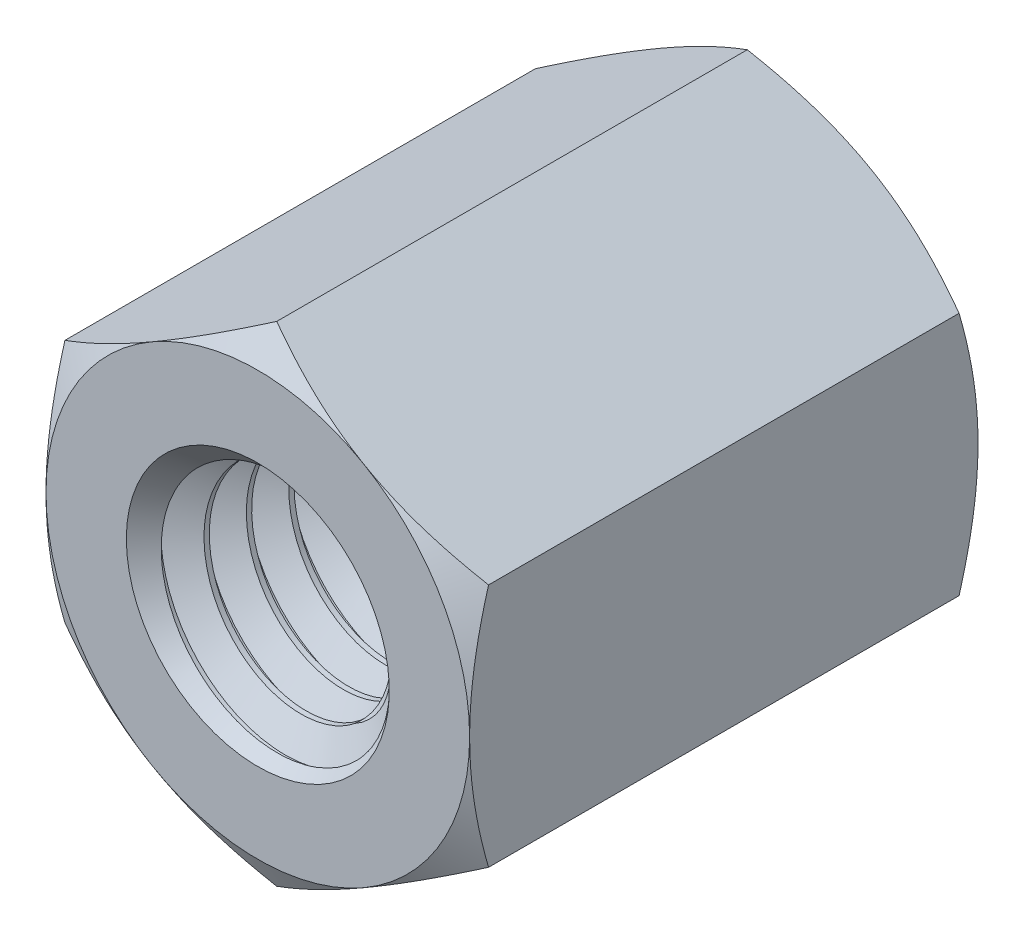
from build123d import *

# Parameters (mm, degrees)
EXTRUDE1_DEPTH          = 4.7625
EXTRUDE1_DEPTH_BACK     = 4.7625
SKETCH1_R               = 2.413
SWEEP1_PITCH            = 0.79375
EXTRUDE2_DEPTH          = 12.967976376
SKETCH8_OUTSIDE_W       = 58.044
SKETCH8_OUTSIDE_H       = 59.272
SKETCH8_OUTSIDE_R       = 3.96875
EXTRUDE4_DEPTH          = 12.967976376
EXTRUDE4_DRAFT          = -60
MIRROR1_COPY_1_SKETCH_W = 58.044
MIRROR1_COPY_1_SKETCH_H = 59.272
MIRROR1_COPY_1_SKETCH_R = 3.96875
MIRROR1_COPY_1_DEPTH    = 12.967976376
MIRROR1_COPY_1_DRAFT    = -60


with BuildPart() as part:
    # Sketch1 → Extrude1 (new, two sides: drawn at the far end of the back side and taken through both)
    with BuildSketch(Plane.XY.offset(-EXTRUDE1_DEPTH_BACK)):
        Polygon((0, 4.582717762), (-3.96875, 2.291358881), (-3.96875, -2.291358881), (0, -4.582717762), (3.96875, -2.291358881), (3.96875, 2.291358881), align=None)
        with Locations(Location((0, 0, 0), (0, 0, 180))):
            Circle(SKETCH1_R, mode=Mode.SUBTRACT)
    extrude(amount=EXTRUDE1_DEPTH + EXTRUDE1_DEPTH_BACK)

    # Sweep1: the profile of Sketch12 profile screwed along a right-hand helix of 13 turns, 8 arcs to a turn; built about Z, then put on its axis
    sweep1_z = Axis((0, 0, 0), (0, 0, 1))
    sweep1_corners = [(2.4133, 0, -0.694704455), (2.4133, 0, 0.000173205), (1.897444252, 0, -0.29765625), (1.897444252, 0, -0.396875)]
    with BuildLine(mode=Mode.PRIVATE) as sweep1_profile:
        Line(sweep1_corners[0], sweep1_corners[1])
        Line(sweep1_corners[1], sweep1_corners[2])
        Line(sweep1_corners[2], sweep1_corners[3])
        Line(sweep1_corners[3], sweep1_corners[0])
    sweep1_cap = Face(sweep1_profile.wire())
    sweep1_turn_angles = [0, 22.5, 45, 67.5, 90, 112.5, 135, 157.5, 180, 202.5, 225, 247.5, 270, 292.5, 315, 337.5, 360]
    sweep1_turn_weights = [1, 0.9238795325112867, 1, 0.9238795325112867, 1, 0.9238795325112867, 1, 0.9238795325112867, 1, 0.9238795325112867, 1, 0.9238795325112867, 1, 0.9238795325112867, 1, 0.9238795325112867, 1]
    sweep1_turn_rails = [Edge.make_bspline([Vector(p[0], p[1], 0).rotate(sweep1_z, sweep1_turn_angles[k]) / sweep1_turn_weights[k] + Vector(0, 0, p[2] + SWEEP1_PITCH * sweep1_turn_angles[k] / 360) for k in range(17)], [0, 0, 0, 1, 1, 2, 2, 3, 3, 4, 4, 5, 5, 6, 6, 7, 7, 8, 8, 8], 2, sweep1_turn_weights) for p in sweep1_corners]
    sweep1_turn_sides = [Face.make_surface_from_curves(sweep1_turn_rails[p[0]], sweep1_turn_rails[p[1]]) for p in [(0, 1), (1, 2), (2, 3), (3, 0)]]
    sweep1 = Plane(origin=(0, 0, -4.7625), x_dir=(0, 1, 0), z_dir=(0, 0, 1)) * Solid(Shell([*[p.moved(Location((0, 0, SWEEP1_PITCH * i))) for i in range(13) for p in sweep1_turn_sides], sweep1_cap, sweep1_cap.rotate(sweep1_z, 4680).moved(Location((0, 0, SWEEP1_PITCH * 4680 / 360)))]))
    add(sweep1)

    # Sketch6 → Extrude2 (cut, through all)
    with BuildSketch(Plane(origin=(0, 0, -4.7625), x_dir=(-1, 0, 0), z_dir=(0, 0, -1))):
        Polygon((0, 4.582717762), (-3.96875, 2.291358881), (-3.96875, -2.291358881), (0, -4.582717762), (3.96875, -2.291358881), (3.96875, 2.291358881), align=None)
    extrude2 = extrude(amount=EXTRUDE2_DEPTH, mode=Mode.SUBTRACT)

    # Extrude3 cone 1 section (through the dimple's axis) → Extrude3 (revolve, cut)
    with BuildSketch(Plane(origin=(0, 0, -4.7625), x_dir=(0, 1, 0), z_dir=(1, 0, 0))):
        Polygon((0, 0), (2.4638, 0), (0, 2.642102028), align=None)
    extrude3 = revolve(axis=Axis((0, 0, -4.7625), (0, 0, 1)), mode=Mode.SUBTRACT)


with BuildPart() as extrude4_tool:
    # Sketch8 outside → Extrude4 (with draft: the straight prism first)
    with BuildSketch(Plane(origin=(0, 0, -4.7625), x_dir=(-1, 0, 0), z_dir=(0, 0, -1))):
        Rectangle(SKETCH8_OUTSIDE_W, SKETCH8_OUTSIDE_H)
        Circle(SKETCH8_OUTSIDE_R, mode=Mode.SUBTRACT)
    extrude(amount=-EXTRUDE4_DEPTH)
    # Extrude4: the draft: its side faces are tilted about the plane it starts from
    extrude4_sides = [extrude4_tool.faces().sort_by_distance(p)[0] for p in [
        (0, -29.636, 1.721488188),
        (-29.022, 0, 1.721488188),
        (0, 29.636, 1.721488188),
        (29.022, 0, 1.721488188),
        (3.96875, 0, 1.721488188),
    ]]
    draft(extrude4_sides, Plane(origin=(0, 0, -4.7625), x_dir=(-1, 0, 0), z_dir=(0, 0, -1)), EXTRUDE4_DRAFT)


with BuildPart() as part_1:
    add(part.part)

    # Extrude4: cut by extrude4_tool
    add(extrude4_tool.part, mode=Mode.SUBTRACT)

    # Mirror1: Extrude2, Extrude3 across plane
    add(extrude2.mirror(Plane.XY), mode=Mode.SUBTRACT)
    add(extrude3.mirror(Plane.XY), mode=Mode.SUBTRACT)


with BuildPart() as mirror1_copy_1_tool:
    # Mirror1 copy 1 sketch → Mirror1 copy 1 (with draft: the straight prism first)
    with BuildSketch(Plane(origin=(0, 0, 4.7625), x_dir=(-1, 0, 0), z_dir=(0, 0, 1))):
        Rectangle(MIRROR1_COPY_1_SKETCH_W, MIRROR1_COPY_1_SKETCH_H)
        Circle(MIRROR1_COPY_1_SKETCH_R, mode=Mode.SUBTRACT)
    extrude(amount=-MIRROR1_COPY_1_DEPTH)
    # Mirror1 copy 1: the draft: its side faces are tilted about the plane it starts from
    mirror1_copy_1_sides = [mirror1_copy_1_tool.faces().sort_by_distance(p)[0] for p in [
        (0, -29.636, -1.721488188),
        (-29.022, 0, -1.721488188),
        (0, 29.636, -1.721488188),
        (29.022, 0, -1.721488188),
        (3.96875, 0, -1.721488188),
    ]]
    draft(mirror1_copy_1_sides, Plane(origin=(0, 0, 4.7625), x_dir=(-1, 0, 0), z_dir=(0, 0, 1)), MIRROR1_COPY_1_DRAFT)


with BuildPart() as part_2:
    add(part_1.part)

    # Mirror1 copy 1: cut by mirror1_copy_1_tool
    add(mirror1_copy_1_tool.part, mode=Mode.SUBTRACT)


solid = part_2.part
